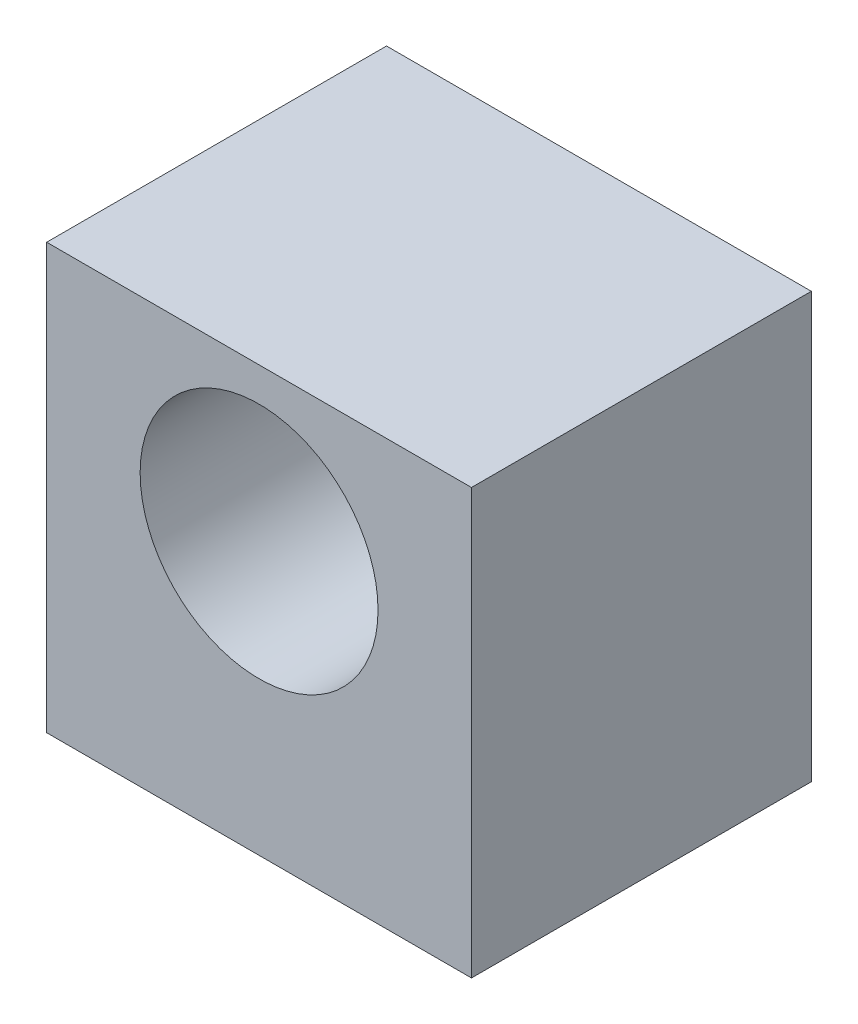
from build123d import *

# Parameters (mm, degrees)
SKETCH1_W             = 50
SKETCH1_H             = 50
BOSS_EXTRUDE1_DEPTH   = 40
SKETCH2_R             = 14
CUT_EXTRUDE1_DEPTH    = 54.38539126
M5_TAPPED_HOLE1_D     = 4.2
M5_TAPPED_HOLE1_DEPTH = 15
M5_TAPPED_HOLE1_TIP   = 1.2618073


with BuildPart() as part:
    # Sketch1 → Boss-Extrude1 (new body)
    with BuildSketch(Plane.XY):
        Rectangle(SKETCH1_W, SKETCH1_H)
    extrude(amount=-BOSS_EXTRUDE1_DEPTH)

    # Sketch2 → Cut-Extrude1 (cut, through all)
    with BuildSketch(Plane.XY):
        with Locations((0, 7)):
            Circle(SKETCH2_R)
    extrude(amount=-CUT_EXTRUDE1_DEPTH, mode=Mode.SUBTRACT)

    # M5 Tapped Hole1
    with Locations(Plane(origin=(-10, -25, -10), x_dir=(-1, 0, 0), z_dir=(0, -1, 0))):
        with Locations((0, 0), (-20, 0), (-20, 20), (0, 20)):
            Hole(M5_TAPPED_HOLE1_D / 2, depth=M5_TAPPED_HOLE1_DEPTH)
            with Locations((0, 0, -(M5_TAPPED_HOLE1_DEPTH + M5_TAPPED_HOLE1_TIP / 2))):  # 118° drill point
                Cone(0, M5_TAPPED_HOLE1_D / 2, M5_TAPPED_HOLE1_TIP, mode=Mode.SUBTRACT)


solid = part.part
